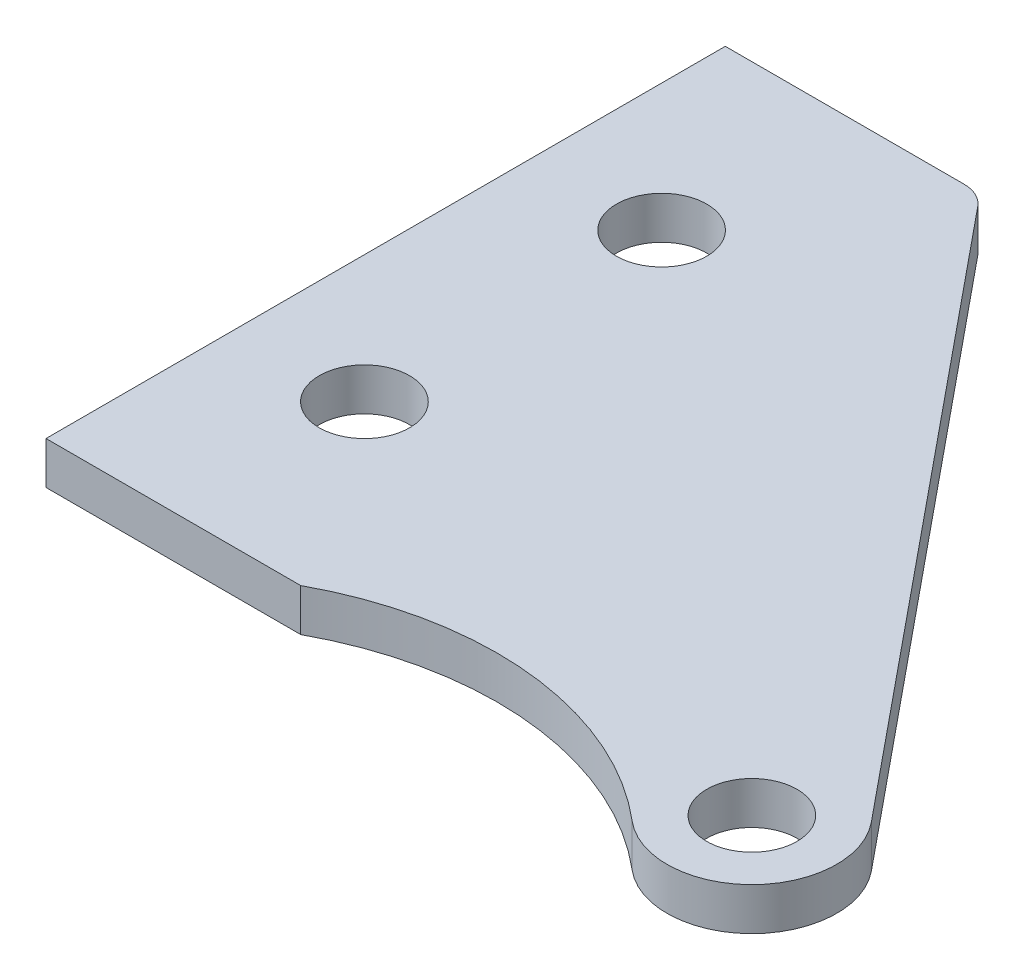
from build123d import *

# Parameters (mm, degrees)
BOSS_EXTRUDE1_DEPTH     = 3.175
F_1_4_CLEARANCE_HOLE2_D = 6.7564
F_1_4_CLEARANCE_HOLE1_D = 6.7564
FILLET1_R               = 2.54


with BuildPart() as part:
    # Sketch1 → Boss-Extrude1 (new body)
    with BuildSketch(Plane(origin=(0, 0, 0), x_dir=(1, 0, 0), z_dir=(0, 1, 0))):
        with BuildLine():
            Line((0, 50.8), (19.05, 50.8))
            Line((19.05, 50.8), (55.713742815, 6.00889778))
            ThreePointArc((55.713742815, 6.00889778), (55.251600463, -2.541572748), (46.694481495, -2.857542328))
            ThreePointArc((46.694481495, -2.857542328), (33.314239893, 2.847224007), (19.05, 0))
            Line((19.05, 0), (0, 0))
            Line((0, 0), (0, 50.8))
        make_face()
    extrude(amount=BOSS_EXTRUDE1_DEPTH)

    # 1/4 Clearance Hole2 (through all)
    with Locations(Plane(origin=(0, 0, 0), x_dir=(-1, 0, 0), z_dir=(0, -1, 0))):
        with Locations((-50.8, 1.986755124)):
            Hole(F_1_4_CLEARANCE_HOLE2_D / 2)

    # 1/4 Clearance Hole1 (through all)
    with Locations(Plane(origin=(0, 3.175, 0), x_dir=(1, 0, 0), z_dir=(0, 1, 0))):
        with Locations((9.525, 36.5125), (9.525, 14.2875)):
            Hole(F_1_4_CLEARANCE_HOLE1_D / 2)

    # Fillet1
    fillet1_edges = [part.edges().sort_by_distance(p)[0] for p in [
        (19.05, 1.5875, -50.8),
    ]]
    fillet(fillet1_edges, radius=FILLET1_R)


solid = part.part
